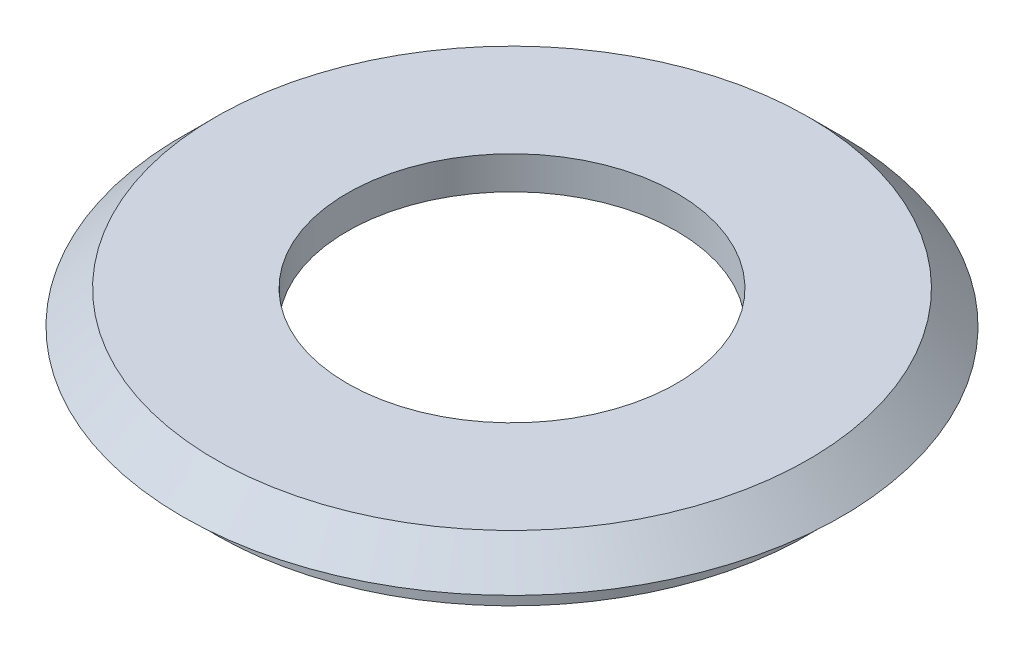
from build123d import *

# Parameters (mm, degrees)
SKETCH1_R           = 100
BOSS_EXTRUDE1_DEPTH = 10
CHAMFER1_SIZE       = 10
SKETCH2_R           = 89.75
SKETCH2_R_2         = 85
BOSS_EXTRUDE2_DEPTH = 10
SKETCH3_R           = 50
CUT_EXTRUDE1_DEPTH  = 20


with BuildPart() as part:
    # Sketch1 → Boss-Extrude1 (new body)
    with BuildSketch(Plane(origin=(0, 0, 0), x_dir=(1, 0, 0), z_dir=(0, 1, 0))):
        with Locations(Location((0, 0, 0), (0, 0, 270))):
            Circle(SKETCH1_R)
    extrude(amount=BOSS_EXTRUDE1_DEPTH)

    # Chamfer1
    chamfer1_edges = [part.edges().sort_by_distance(p)[0] for p in [
        (0, 10, -100),
    ]]
    chamfer(chamfer1_edges, length=CHAMFER1_SIZE - 0.0001)  # a hair under: the kernel refuses the full size

    # Sketch2 → Boss-Extrude2 (add)
    with BuildSketch(Plane.XZ):
        with Locations(Location((0, 0, 0), (0, 0, 90))):
            Circle(SKETCH2_R)
        with Locations(Location((0, 0, 0), (0, 0, 270))):
            Circle(SKETCH2_R_2, mode=Mode.SUBTRACT)
    extrude(amount=BOSS_EXTRUDE2_DEPTH)

    # Sketch3 → Cut-Extrude1 (cut)
    with BuildSketch(Plane(origin=(0, 10, 0), x_dir=(1, 0, 0), z_dir=(0, 1, 0))):
        with Locations(Location((0, 0, 0), (0, 0, 270))):
            Circle(SKETCH3_R)
    extrude(amount=-CUT_EXTRUDE1_DEPTH, mode=Mode.SUBTRACT)


solid = part.part
